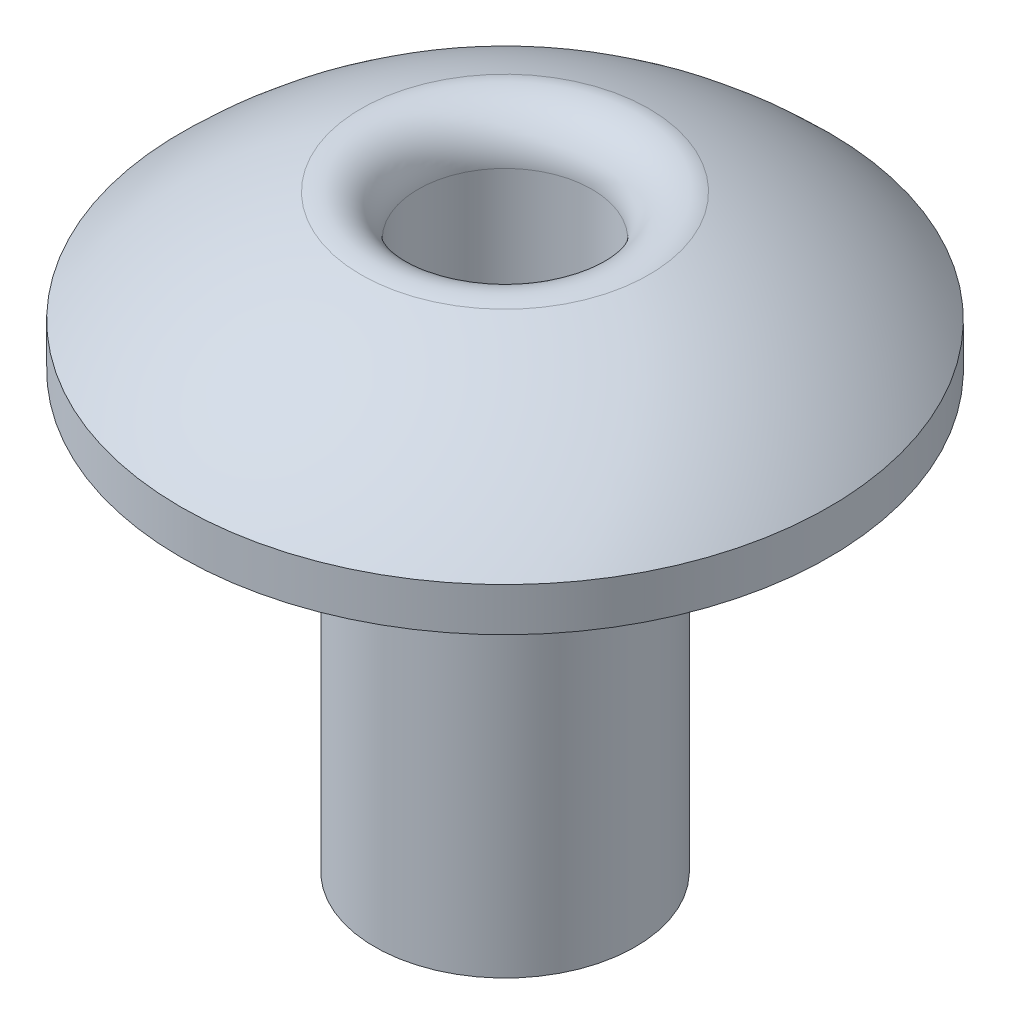
from build123d import *

# Parameters (mm, degrees)
SKETCH3_R           = 1.5
BOSS_EXTRUDE1_DEPTH = 5
SKETCH4_R           = 1
CUT_EXTRUDE1_DEPTH  = 9.801880823
FILLET1_R           = 0.5


with BuildPart() as part:
    # Sketch2 → Revolve2 (revolve)
    with BuildSketch(Plane(origin=(0, 0, 0), x_dir=(0, 0, -1), z_dir=(1, 0, 0))):
        with BuildLine():
            Line((0, 1.54531685), (0, 0))
            Line((0, 0), (0, -0.5))
            Line((0, -0.5), (-3.730724896, -0.5))
            Line((-3.730724896, -0.5), (-3.730724896, 0))
            ThreePointArc((-3.730724896, 0), (-2.019053765, 1.143702085), (0, 1.54531685))
        make_face()
    revolve(axis=Axis((0, -0.5, 0), (0, 1, 0)))

    # Sketch3 → Boss-Extrude1 (add)
    with BuildSketch(Plane.XZ.offset(0.5)):
        Circle(SKETCH3_R)
    extrude(amount=BOSS_EXTRUDE1_DEPTH)

    # Sketch4 → Cut-Extrude1 (cut, through all)
    with BuildSketch(Plane.XZ.offset(5.5)):
        Circle(SKETCH4_R)
    extrude(amount=-CUT_EXTRUDE1_DEPTH, mode=Mode.SUBTRACT)

    # Fillet1
    fillet1_edges = [part.edges().sort_by_distance(p)[0] for p in [
        (-0.707106781, 1.449682086, -0.707106781),
    ]]
    fillet(fillet1_edges, radius=FILLET1_R)


solid = part.part
